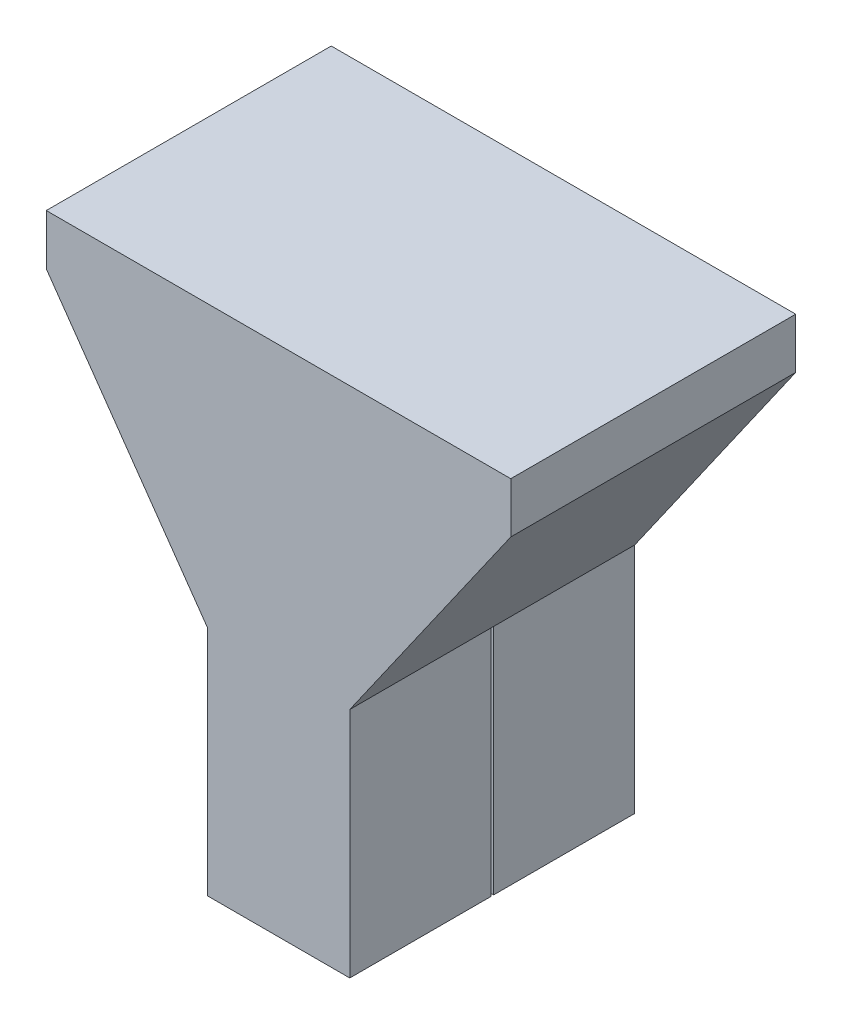
from build123d import *

# Parameters (mm, degrees)
AUFSATZ_LINEAR_AUSTRAGEN1_DEPTH      = 500
LINEARES_MUSTER1_COUNT               = 2
LINEARES_MUSTER1_PITCH               = 250
SCHNITT_LINEAR_AUSTRAGEN1_DEPTH      = 2.5
SCHNITT_LINEAR_AUSTRAGEN1_DEPTH_BACK = 2.5
SKIZZE12_W                           = 220
SKIZZE12_H                           = 408
SKIZZE4_R                            = 25
SKIZZE11_W                           = 35
SKIZZE11_H                           = 35
AUFSATZ_LINEAR_AUSTRAGEN3_DEPTH      = 35


with BuildPart() as part:
    # Skizze1 → Aufsatz-Linear austragen1 (new body)
    with BuildSketch(Plane.XY):
        Polygon((0, 0), (0, 900), (407.5, 900), (407.5, 811.451811905), (125, 408), (125, 0), align=None)
    aufsatz_linear_austragen1 = extrude(amount=AUFSATZ_LINEAR_AUSTRAGEN1_DEPTH)

    # Skizze2 → Schnitt-Rotation1 (revolve, cut)
    with BuildSketch(Plane.ZY):
        Polygon((125, 0), (125, 30), (135, 30), (140, 20), (140, 0), align=None)
    schnitt_rotation1 = revolve(axis=Axis((0, 0, 125), (0, 1, 0)), mode=Mode.SUBTRACT)

    # Spiegeln1: Aufsatz-Linear austragen1, Schnitt-Rotation1 across plane
    add(aufsatz_linear_austragen1.mirror(Plane(origin=(0, 0, 500), x_dir=(0, 0, 1), z_dir=(1, 0, 0))))
    add(schnitt_rotation1.mirror(Plane(origin=(0, 0, 500), x_dir=(0, 0, 1), z_dir=(1, 0, 0))), mode=Mode.SUBTRACT)

    # Lineares Muster1: Schnitt-Rotation1 ×2
    with Locations(*[(0, 0, i * LINEARES_MUSTER1_PITCH) for i in range(1, LINEARES_MUSTER1_COUNT)]):
        add(schnitt_rotation1, mode=Mode.SUBTRACT)

    # Skizze12 → Schnitt-Linear austragen1 (cut, two sides: drawn at the far end of the back side and taken through both)
    with BuildSketch(Plane(origin=(0, 0, 250), x_dir=(-1, 0, 0), z_dir=(0, 0, -1)).offset(-SCHNITT_LINEAR_AUSTRAGEN1_DEPTH_BACK)):
        with Locations((-15, 204)):
            Rectangle(SKIZZE12_W, SKIZZE12_H)
    extrude(amount=SCHNITT_LINEAR_AUSTRAGEN1_DEPTH + SCHNITT_LINEAR_AUSTRAGEN1_DEPTH_BACK, mode=Mode.SUBTRACT)

    # Austragung1: sweep along a path in Skizze5
    with BuildLine(Plane(origin=(0, 0, 0), x_dir=(0, 0, -1), z_dir=(1, 0, 0))) as austragung1_path:
        Line((0, 225), (25, 250))
    # Skizze4 → Austragung1 (sweep)
    with BuildSketch(Plane(origin=(0, 0, 0), x_dir=(-1, 0, 0), z_dir=(0, 0, -1))):
        with Locations((0, 225)):
            Circle(SKIZZE4_R)
    sweep(path=austragung1_path.line)

    # Skizze11 → Aufsatz-Linear austragen3 (add)
    with BuildSketch(Plane(origin=(0, 0, -25), x_dir=(-1, 0, 0), z_dir=(0, 0, -1))):
        with Locations((0, 250)):
            Rectangle(SKIZZE11_W, SKIZZE11_H)
    extrude(amount=AUFSATZ_LINEAR_AUSTRAGEN3_DEPTH)


solid = part.part
